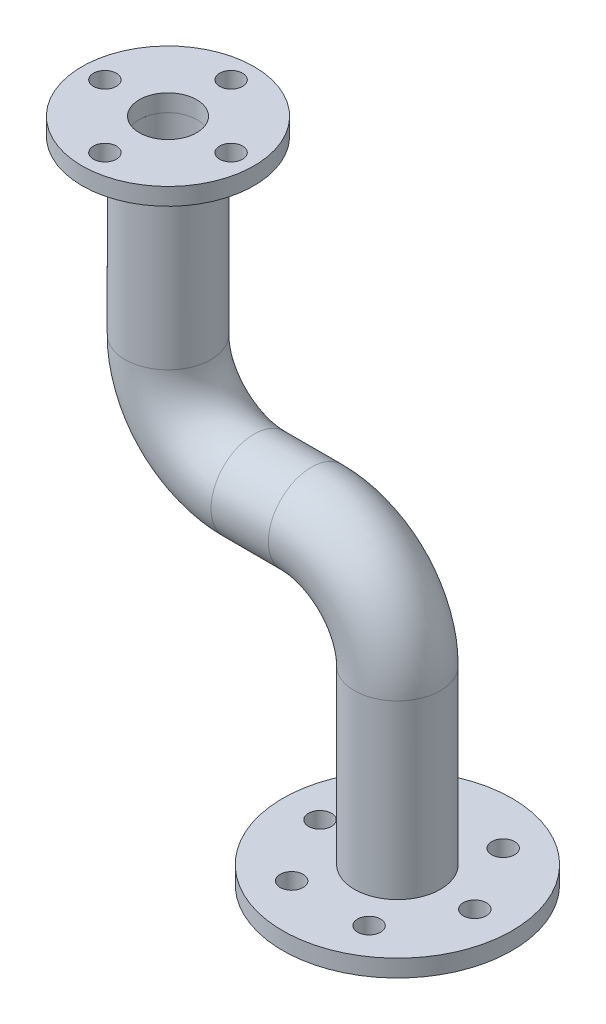
from build123d import *

# Parameters (mm, degrees)
SWEEP1_PROFILE_R     = 37.5
CUT_SWEEP1_PROFILE_R = 25
SKETCH27_R           = 75
SKETCH27_R_2         = 25
BOSS_EXTRUDE3_DEPTH  = 15
SKETCH25_R           = 100
SKETCH25_R_2         = 25
BOSS_EXTRUDE4_DEPTH  = 15
HOLE1_START          = -240
HOLE1_OUTLINE_R      = 10
HOLE1_DEPTH          = 15
CIRPATTERN1_COUNT    = 6
HOLE2_START          = 225
HOLE2_OUTLINE_R      = 10
HOLE2_DEPTH          = 15
CIRPATTERN2_COUNT    = 4


# Read off the part's stored shape, not the designer's step: Hole1, Hole2
with BuildPart() as part:
    # Sweep1: sweep along a path in Sketch1
    with BuildLine(Plane.XY) as sweep1_path:
        Line((-100, 225), (-100, 75))
        ThreePointArc((-100, 75), (-78.033008589, 21.966991411), (-25, 0))
        Line((-25, 0), (25, 0))
        ThreePointArc((25, 0), (78.033008589, -21.966991411), (100, -75))
        Line((100, -75), (100, -225))
    # Sweep1 profile (on start of the path) → Sweep1 (sweep)
    with BuildSketch(Plane(origin=(-100, 225, 0), x_dir=(0, 0, -1), z_dir=(0, -1, 0))):
        Circle(SWEEP1_PROFILE_R)
    sweep(path=sweep1_path.line)

    # Cut-Sweep1: sweep along a path in Sketch1<4>
    with BuildLine(Plane.XY) as cut_sweep1_path:
        Line((-100, 225), (-100, 75))
        ThreePointArc((-100, 75), (-78.033008589, 21.966991411), (-25, 0))
        Line((-25, 0), (25, 0))
        ThreePointArc((25, 0), (78.033008589, -21.966991411), (100, -75))
        Line((100, -75), (100, -225))
    # Cut-Sweep1 profile (on start of the path) → Cut-Sweep1 (sweep, cut)
    with BuildSketch(Plane(origin=(-100, 225, 0), x_dir=(0, 0, -1), z_dir=(0, -1, 0))):
        Circle(CUT_SWEEP1_PROFILE_R)
    sweep(path=cut_sweep1_path.line, mode=Mode.SUBTRACT)


with BuildPart() as body_2:
    # Sketch27 → Boss-Extrude3 (new body)
    with BuildSketch(Plane(origin=(0, 225, 0), x_dir=(1, 0, 0), z_dir=(0, 1, 0))):
        with Locations(Location((-100, 0, 0), (0, 0, 270))):
            Circle(SKETCH27_R)
        with Locations(Location((-100, 0, 0), (0, 0, 270))):
            Circle(SKETCH27_R_2, mode=Mode.SUBTRACT)
    extrude(amount=BOSS_EXTRUDE3_DEPTH)

    # Hole2 outline → Hole2 (cut)
    with BuildSketch(Plane(origin=(0, 0, 0), x_dir=(1, 0, 0), z_dir=(0, 1, 0)).offset(HOLE2_START)):
        with Locations((-45, 0)):
            Circle(HOLE2_OUTLINE_R)
    hole2 = extrude(amount=HOLE2_DEPTH, mode=Mode.SUBTRACT)

    # CirPattern2: Hole2 ×4 about axis
    cirpattern2_axis = Axis((-100, 0, 0), (0, 1, 0))
    for i in range(1, CIRPATTERN2_COUNT):
        add(hole2.rotate(cirpattern2_axis, i * 360 / CIRPATTERN2_COUNT), mode=Mode.SUBTRACT)


with BuildPart() as body_3:
    # Sketch25 → Boss-Extrude4 (new body)
    with BuildSketch(Plane.XZ.offset(225)):
        with Locations(Location((100, 0, 0), (0, 0, 270))):
            Circle(SKETCH25_R)
        with Locations(Location((100, 0, 0), (0, 0, 270))):
            Circle(SKETCH25_R_2, mode=Mode.SUBTRACT)
    extrude(amount=BOSS_EXTRUDE4_DEPTH)

    # Hole1 outline → Hole1 (cut)
    with BuildSketch(Plane(origin=(0, 0, 0), x_dir=(1, 0, 0), z_dir=(0, 1, 0)).offset(HOLE1_START)):
        with Locations((32.5, 0)):
            Circle(HOLE1_OUTLINE_R)
    hole1 = extrude(amount=HOLE1_DEPTH, mode=Mode.SUBTRACT)

    # CirPattern1: Hole1 ×6 about axis
    cirpattern1_axis = Axis((100, 0, 0), (0, 1, 0))
    for i in range(1, CIRPATTERN1_COUNT):
        add(hole1.rotate(cirpattern1_axis, i * 360 / CIRPATTERN1_COUNT), mode=Mode.SUBTRACT)


solid = Compound([part.part, body_2.part, body_3.part])
